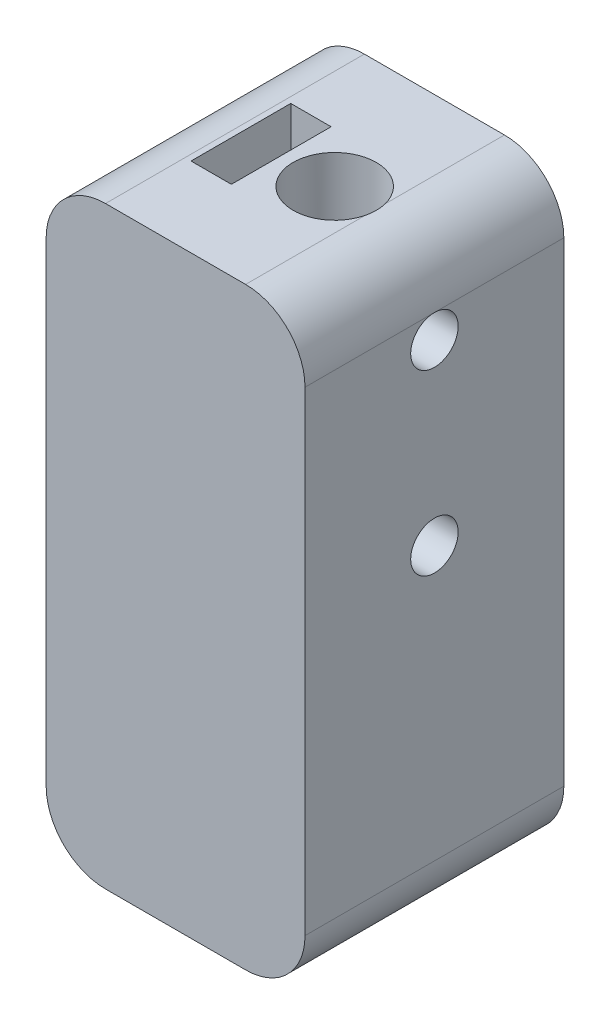
from build123d import *

# Parameters (mm, degrees)
CROQUIS1_W              = 21.8
CROQUIS1_H              = 50
SALIENTE_EXTRUIR1_DEPTH = 21.8
CROQUIS6_R              = 2
CORTAR_EXTRUIR2_DEPTH   = 21.8
CORTAR_EXTRUIR4_REACH   = 60.741
CROQUIS11_R             = 3.5
CROQUIS11_W             = 3.4
CROQUIS11_H             = 8.4
REDONDEO1_R             = 5
CROQUIS13_R             = 3.5
CORTAR_EXTRUIR6_DEPTH   = 3.5
CROQUIS15_W             = 3.4
CROQUIS15_H             = 8.4
SALIENTE_EXTRUIR2_DEPTH = 13


with BuildPart() as part:
    # Croquis1 → Saliente-Extruir1 (new body)
    with BuildSketch(Plane(origin=(0, 0, 0), x_dir=(0, 0, -1), z_dir=(1, 0, 0))):
        with Locations((-10.9, -25)):
            Rectangle(CROQUIS1_W, CROQUIS1_H)
    extrude(amount=SALIENTE_EXTRUIR1_DEPTH)

    # Croquis6 → Cortar-Extruir2 (cut)
    with BuildSketch(Plane.ZY):
        with Locations((10.9, -22)):
            Circle(CROQUIS6_R)
        with Locations((10.9, -7)):
            Circle(CROQUIS6_R)
    extrude(amount=-CORTAR_EXTRUIR2_DEPTH, mode=Mode.SUBTRACT)

    # Croquis11 → Cortar-Extruir4 (cut, up to next)
    with BuildSketch(Plane.XZ.offset(50), mode=Mode.PRIVATE) as cortar_extruir4_sk1:
        with Locations(Location((13.4, 10.9, 0), (0, 0, 270))):
            Circle(CROQUIS11_R)
    cortar_extruir4_tool1 = extrude(cortar_extruir4_sk1.sketch, amount=-CORTAR_EXTRUIR4_REACH, mode=Mode.PRIVATE) & part.part
    # Croquis11 → Cortar-Extruir4 (cut, up to next)
    with BuildSketch(Plane.XZ.offset(50), mode=Mode.PRIVATE) as cortar_extruir4_sk2:
        with Locations((7.2, 10.9)):
            Rectangle(CROQUIS11_W, CROQUIS11_H)
    cortar_extruir4_tool2 = extrude(cortar_extruir4_sk2.sketch, amount=-CORTAR_EXTRUIR4_REACH, mode=Mode.PRIVATE) & part.part
    add(cortar_extruir4_tool1.solids().sort_by_distance((13.4, -50, 10.9))[0], mode=Mode.SUBTRACT)
    add(cortar_extruir4_tool2.solids().sort_by_distance((7.2, -50, 10.9))[0], mode=Mode.SUBTRACT)

    # Redondeo1
    # the kernel refuses this fillet: 5 mm, written as the material it takes off along each edge
    with BuildSketch(Plane(origin=(21.8, -50, 34.3), x_dir=(0, 1, 0), z_dir=(0, 0, -1)), Plane(origin=(0, 0, -12.5), x_dir=(1, 0, 0), z_dir=(0, 0, 1))) as redondeo1_piece_1:
        with BuildLine():
            CenterArc((REDONDEO1_R, -REDONDEO1_R), REDONDEO1_R, 90, 90)
            Line((0, -REDONDEO1_R), (0, 0))
            Line((0, 0), (REDONDEO1_R, 0))
        make_face()
    extrude(amount=46.8, mode=Mode.SUBTRACT)
    with BuildSketch(Plane(origin=(21.8, 0, -12.5), x_dir=(-1, 0, 0), z_dir=(0, 0, 1)), Plane(origin=(0, -50, 34.3), x_dir=(0, 1, 0), z_dir=(0, 0, -1))) as redondeo1_piece_2:
        with BuildLine():
            CenterArc((REDONDEO1_R, REDONDEO1_R), REDONDEO1_R, 180, 90)
            Line((0, REDONDEO1_R), (0, 0))
            Line((0, 0), (REDONDEO1_R, 0))
        make_face()
    extrude(amount=46.8, mode=Mode.SUBTRACT)

    # Croquis13 → Cortar-Extruir6 (cut)
    with BuildSketch(Plane.ZY):
        with Locations((10.9, -7)):
            Circle(CROQUIS13_R)
        with Locations((10.9, -22)):
            Circle(CROQUIS13_R)
    extrude(amount=-CORTAR_EXTRUIR6_DEPTH, mode=Mode.SUBTRACT)

    # Croquis15 → Saliente-Extruir2 (add)
    with BuildSketch(Plane.XZ.offset(50)):
        with Locations((7.2, 10.9)):
            Rectangle(CROQUIS15_W, CROQUIS15_H)
        with BuildLine():
            ThreePointArc((16.8, 10.069337614), (16.9, 10.9), (16.8, 11.730662386))
            ThreePointArc((16.8, 11.730662386), (9.9, 10.9), (16.8, 10.069337614))
        make_face()
    extrude(amount=-SALIENTE_EXTRUIR2_DEPTH)


solid = part.part
